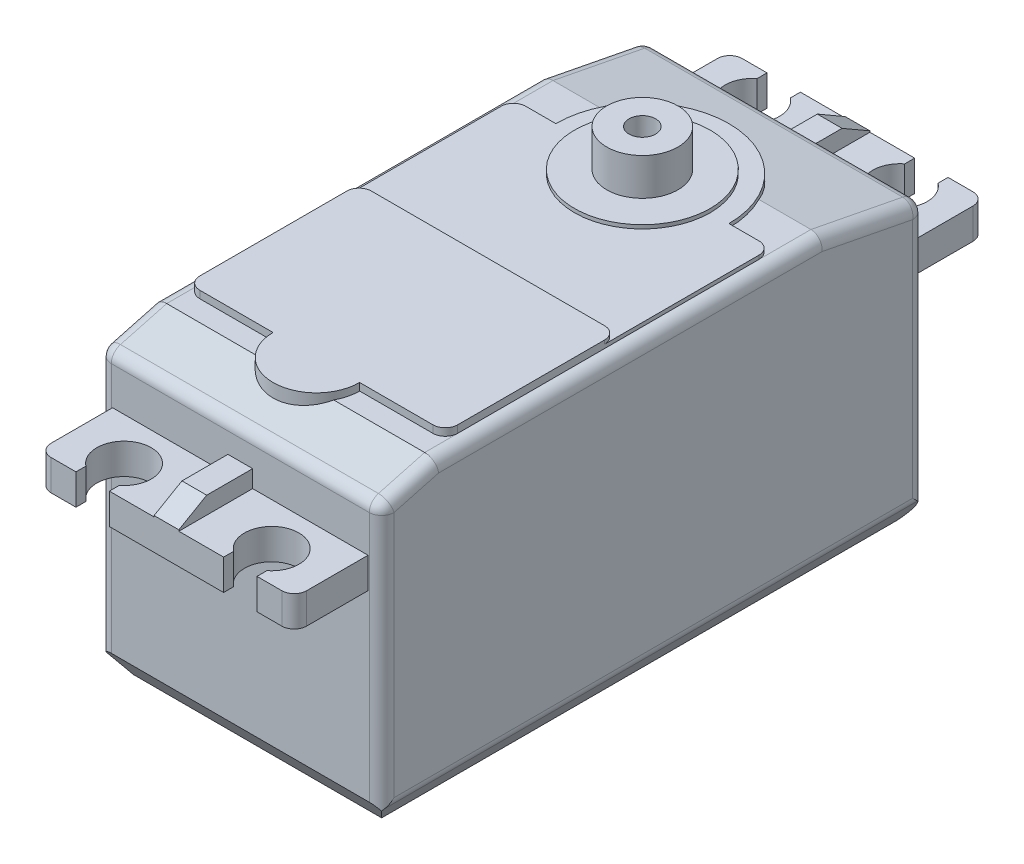
from build123d import *
from OCP.BRepFilletAPI import BRepFilletAPI_MakeChamfer

# Parameters (mm, degrees)
SKETCH_1_W           = 55.88
SKETCH_1_H           = 24.55
EXTRUDE_1_DEPTH      = 22.86
SKETCH_2_W           = 5.969
SKETCH_2_H           = 16.764
CUT_EXTRUDE_1_DEPTH  = 52.049676404
SKETCH_3_W           = 5.969
SKETCH_3_H           = 5.306
CUT_EXTRUDE_2_DEPTH  = 52.049676404
SKETCH_7_W           = 2
SKETCH_7_H           = 1.4
EXTRUDE_2_DEPTH      = 5.969
EXTRUDE_START        = -43.942
SKETCH_7_2_W         = 2
SKETCH_7_2_H         = 1.4
EXTRUDE_5_DEPTH      = 5.969
CUT_EXTRUDE_4_DEPTH  = 45.517005706
SKETCH_12_W          = 7
SKETCH_12_H          = 4
EXTRUDE_4_DEPTH      = 6
EXTRUDE_4_TAPER      = 6
CHAMFER_1_SIZE       = 1.3
CHAMFER_1_SIZE2      = 2.25166605
SKETCH_18_W          = 22.86
SKETCH_18_H          = 43.942
CUT_EXTRUDE_9_DEPTH  = 0.3
EXTRUDE_START_2      = 0.3
EXTRUDE_6_DEPTH      = 0.3
SKETCH_20_W          = 5.969
SKETCH_20_H          = 2.48
CUT_EXTRUDE_10_DEPTH = 1.1
SKETCH_21_W          = 5.969
SKETCH_21_H          = 2.48
CUT_EXTRUDE_11_DEPTH = 1.1
CHAMFER_3_SIZE       = 1.6
CHAMFER_3_SIZE_2     = 8.231286426
CHAMFER_4_SIZE       = 1.2
CHAMFER_4_SIZE_2     = 4.478460969
CHAMFER_5_SIZE       = 2
CHAMFER_5_SIZE2      = 1.400415076
FILLET_1_R           = 1


with BuildPart() as part:
    # Эскиз1 → Бобышка-Вытянуть1 (new body)
    with BuildSketch(Plane(origin=(11.43, 0, 0), x_dir=(0, 0, -1), z_dir=(1, 0, 0))):
        with Locations((-10.541, -12.275)):
            Rectangle(SKETCH_1_W, SKETCH_1_H)
    extrude(amount=-EXTRUDE_1_DEPTH)

    # Эскиз2 → Вырез-Вытянуть1 (cut, through all)
    with BuildSketch(Plane.ZY.offset(11.43)):
        with Locations((-14.4145, -16.168)):
            Rectangle(SKETCH_2_W, SKETCH_2_H)
        with Locations((35.4965, -16.168)):
            Rectangle(SKETCH_2_W, SKETCH_2_H)
    extrude(amount=-CUT_EXTRUDE_1_DEPTH, mode=Mode.SUBTRACT)

    # Эскиз3 → Вырез-Вытянуть2 (cut, through all)
    with BuildSketch(Plane.ZY.offset(11.43)):
        with Locations((-14.4145, -2.653)):
            Rectangle(SKETCH_3_W, SKETCH_3_H)
        with Locations((35.4965, -2.653)):
            Rectangle(SKETCH_3_W, SKETCH_3_H)
    extrude(amount=-CUT_EXTRUDE_2_DEPTH, mode=Mode.SUBTRACT)

    # Эскиз7 → Бобышка-Вытянуть2 (add)
    with BuildSketch(Plane(origin=(0, 0, -11.43), x_dir=(-1, 0, 0), z_dir=(0, 0, -1))):
        with Locations((0, -4.606)):
            Rectangle(SKETCH_7_W, SKETCH_7_H)
    extrude(amount=EXTRUDE_2_DEPTH)

    # Эскиз7<2> → Бобышка-Вытянуть5 (add)
    with BuildSketch(Plane(origin=(0, 0, -11.43), x_dir=(-1, 0, 0), z_dir=(0, 0, -1)).offset(EXTRUDE_START)):
        with Locations((0, -4.606)):
            Rectangle(SKETCH_7_2_W, SKETCH_7_2_H)
    extrude(amount=-EXTRUDE_5_DEPTH)

    # Эскиз5 → Вырез-Вытянуть4 (cut, through all)
    with BuildSketch(Plane(origin=(0, -5.306, 0), x_dir=(-1, 0, 0), z_dir=(0, 1, 0))):
        with BuildLine():
            Line((4.62, -17.399), (7.32, -17.399))
            Line((7.32, -17.399), (7.32, -16.596095277))
            ThreePointArc((7.32, -16.596095277), (5.97, -12.659), (4.62, -16.596095277))
            Line((4.62, -16.596095277), (4.62, -17.399))
        make_face()
        with BuildLine():
            Line((-7.32, -17.399), (-4.62, -17.399))
            Line((-4.62, -17.399), (-4.62, -16.596095277))
            ThreePointArc((-4.62, -16.596095277), (-5.97, -12.659), (-7.32, -16.596095277))
            Line((-7.32, -16.596095277), (-7.32, -17.399))
        make_face()
        with BuildLine():
            Line((-7.32, 37.678095277), (-7.32, 38.481))
            Line((-7.32, 38.481), (-4.62, 38.481))
            Line((-4.62, 38.481), (-4.62, 37.678095277))
            ThreePointArc((-4.62, 37.678095277), (-5.97, 33.741), (-7.32, 37.678095277))
        make_face()
        with BuildLine():
            Line((4.62, 37.678095277), (4.62, 38.481))
            Line((4.62, 38.481), (7.32, 38.481))
            Line((7.32, 38.481), (7.32, 37.678095277))
            ThreePointArc((7.32, 37.678095277), (5.97, 33.741), (4.62, 37.678095277))
        make_face()
    extrude(amount=-CUT_EXTRUDE_4_DEPTH, mode=Mode.SUBTRACT)

    # Эскиз12 → Бобышка-Вытянуть4 (add)
    with BuildSketch(Plane(origin=(0, 0, -11.43), x_dir=(-1, 0, 0), z_dir=(0, 0, -1))):
        with Locations((0, -20.05)):
            Rectangle(SKETCH_12_W, SKETCH_12_H)
    extrude(amount=EXTRUDE_4_DEPTH, taper=EXTRUDE_4_TAPER)

    # Эскиз13 → Повернуть1 (revolve)
    with BuildSketch(Plane.XY, mode=Mode.PRIVATE) as revolve_1_sk:
        Polygon((2.88, 3.3), (1.075, 3.3), (1.075, 0), (5.49, 0), (5.49, 0.3), (2.88, 0.3), align=None)
    revolve(revolve_1_sk.sketch.rotate(Axis((0, 3.776863246, 0), (0, -1, 0)), 270), axis=Axis((0, 3.776863246, 0), (0, -1, 0)))

    # Фаска1: one chamfer whose edges measure the first distance from different faces: ONE call of the kernel's chamfer builder (chamfer() names one face for all edges)
    chamfer_1_edges_1 = [part.edges().sort_by_distance(p)[0] for p in [
        (0, -3.906, -17.399),
    ]]
    chamfer_1_side_1 = [part.faces().sort_by_distance(p)[0] for p in [
        (0, -6.334763066, -17.399),
    ]]
    chamfer_1_edges_2 = [part.edges().sort_by_distance(p)[0] for p in [
        (0, -3.906, 38.481),
    ]]
    chamfer_1_side_2 = [part.faces().sort_by_distance(p)[0] for p in [
        (0, -6.334763066, 38.481),
    ]]
    chamfer_1 = BRepFilletAPI_MakeChamfer(part.part.solid().wrapped)
    for e in chamfer_1_edges_1:
        chamfer_1.Add(CHAMFER_1_SIZE, CHAMFER_1_SIZE2, e.wrapped, chamfer_1_side_1[0].wrapped)  # the first distance lies on this face
    for e in chamfer_1_edges_2:
        chamfer_1.Add(CHAMFER_1_SIZE, CHAMFER_1_SIZE2, e.wrapped, chamfer_1_side_2[0].wrapped)  # the first distance lies on this face
    add(Compound.cast(chamfer_1.Shape()), mode=Mode.REPLACE)

    # Эскиз18 → Вырез-Вытянуть9 (cut)
    with BuildSketch(Plane(origin=(0, 0, 0), x_dir=(1, 0, 0), z_dir=(0, 1, 0))):
        with Locations((0, -10.541)):
            Rectangle(SKETCH_18_W, SKETCH_18_H)
        with BuildLine():
            Line((-10.425, -25.36), (-10.425, -1))
            ThreePointArc((-10.425, -1), (-10.132106781, -0.292893219), (-9.425, 0))
            Line((-9.425, 0), (-7, 0))
            ThreePointArc((-7, 0), (0, 7), (7, 0))
            Line((7, 0), (9.425, 0))
            ThreePointArc((9.425, 0), (10.132106781, -0.292893219), (10.425, -1))
            Line((10.425, -1), (10.425, -25.36))
            ThreePointArc((10.425, -25.36), (10.132106781, -26.067106781), (9.425, -26.36))
            Line((9.425, -26.36), (3.5, -26.36))
            ThreePointArc((3.5, -26.36), (0, -29.86), (-3.5, -26.36))
            Line((-3.5, -26.36), (-9.425, -26.36))
            ThreePointArc((-9.425, -26.36), (-10.132106781, -26.067106781), (-10.425, -25.36))
        make_face(mode=Mode.SUBTRACT)
    extrude(amount=-CUT_EXTRUDE_9_DEPTH, mode=Mode.SUBTRACT)

    # Эскиз19 → Бобышка-Вытянуть6 (add)
    with BuildSketch(Plane(origin=(0, 0, 0), x_dir=(1, 0, 0), z_dir=(0, 1, 0)).offset(EXTRUDE_START_2)):
        with BuildLine():
            Line((-9.425, -12.48), (9.425, -12.48))
            ThreePointArc((9.425, -12.48), (10.132106781, -12.772893219), (10.425, -13.48))
            Line((10.425, -13.48), (10.425, -25.36))
            ThreePointArc((10.425, -25.36), (10.132106781, -26.067106781), (9.425, -26.36))
            Line((9.425, -26.36), (3.5, -26.36))
            ThreePointArc((3.5, -26.36), (0, -29.86), (-3.5, -26.36))
            Line((-3.5, -26.36), (-9.425, -26.36))
            ThreePointArc((-9.425, -26.36), (-10.132106781, -26.067106781), (-10.425, -25.36))
            Line((-10.425, -25.36), (-10.425, -13.48))
            ThreePointArc((-10.425, -13.48), (-10.132106781, -12.772893219), (-9.425, -12.48))
        make_face()
    extrude(amount=-EXTRUDE_6_DEPTH)

    # Эскиз20 → Вырез-Вытянуть10 (cut)
    with BuildSketch(Plane(origin=(11.43, 0, 0), x_dir=(0, 0, -1), z_dir=(1, 0, 0))):
        with Locations((-35.4965, -6.546)):
            Rectangle(SKETCH_20_W, SKETCH_20_H)
        with Locations((14.4145, -6.546)):
            Rectangle(SKETCH_20_W, SKETCH_20_H)
    extrude(amount=-CUT_EXTRUDE_10_DEPTH, mode=Mode.SUBTRACT)

    # Эскиз21 → Вырез-Вытянуть11 (cut)
    with BuildSketch(Plane.ZY.offset(11.43)):
        with Locations((-14.4145, -6.546)):
            Rectangle(SKETCH_21_W, SKETCH_21_H)
        with Locations((35.4965, -6.546)):
            Rectangle(SKETCH_21_W, SKETCH_21_H)
    extrude(amount=-CUT_EXTRUDE_11_DEPTH, mode=Mode.SUBTRACT)

    # Фаска3
    # the kernel refuses this chamfer: 8.231286426, 1.6 mm, written as the material it takes off along each edge
    with BuildSketch(Plane(origin=(32.816798232, -0.3, -11.43), x_dir=(0, -0.9816291836389957, -0.19079870499623175), z_dir=(-1, 0, 0))) as chamfer_3_piece_1_section:
        Polygon((CHAMFER_3_SIZE * 0.981629183639, CHAMFER_3_SIZE * 0.190798704996), (-CHAMFER_3_SIZE_2 * 0.190798704986, CHAMFER_3_SIZE_2 * 0.981629183586), (0, 0), align=None)
    chamfer_3_piece_1 = extrude(amount=65.633596465, mode=Mode.PRIVATE)
    chamfer_3_piece_1 = chamfer_3_piece_1 - Plane(origin=(0, -0.754444143, 0), x_dir=(-1, 0, 0), z_dir=(0, 1, 0)) * Cylinder(7, 164, mode=Mode.PRIVATE)
    add(chamfer_3_piece_1, mode=Mode.SUBTRACT)

    # Фаска4
    # the kernel refuses this chamfer: 4.478460969, 1.2 mm, written as the material it takes off along each edge
    with BuildSketch(Plane(origin=(-23.0593162, -0.3, 32.512), x_dir=(0, -0.9905000388259542, 0.13751244702129095), z_dir=(1, 0, 0))) as chamfer_4_piece_1_section:
        Polygon((CHAMFER_4_SIZE * 0.990500038826, CHAMFER_4_SIZE * 0.137512447021), (-CHAMFER_4_SIZE_2 * 0.137512447024, CHAMFER_4_SIZE_2 * 0.990500038844), (0, 0), align=None)
    chamfer_4_piece_1 = extrude(amount=46.118632399, mode=Mode.PRIVATE)
    chamfer_4_piece_1 = chamfer_4_piece_1 - Plane(origin=(0, -0.658812449, 26.36), x_dir=(1, 0, 0), z_dir=(0, 1, 0)) * Cylinder(3.5, 110, mode=Mode.PRIVATE)
    add(chamfer_4_piece_1, mode=Mode.SUBTRACT)

    # Фаска5: one chamfer whose edges measure the first distance from different faces: ONE call of the kernel's chamfer builder (chamfer() names one face for all edges)
    chamfer_5_edges_1 = [part.edges().sort_by_distance(p)[0] for p in [
        (11.43, -24.55, 10.541),
    ]]
    chamfer_5_side_1 = [part.faces().sort_by_distance(p)[0] for p in [
        (11.43, -12.527087713, 10.608768659),
    ]]
    chamfer_5_edges_2 = [part.edges().sort_by_distance(p)[0] for p in [
        (-11.43, -24.55, 10.541),
    ]]
    chamfer_5_side_2 = [part.faces().sort_by_distance(p)[0] for p in [
        (-11.43, -12.527087713, 10.608768659),
    ]]
    chamfer_5_edges_3 = [part.edges().sort_by_distance(p)[0] for p in [
        (0, -24.55, 32.512),
    ]]
    chamfer_5_side_3 = [part.faces().sort_by_distance(p)[0] for p in [
        (0, -13.776843524, 32.512),
    ]]
    chamfer_5 = BRepFilletAPI_MakeChamfer(part.part.solid().wrapped)
    for e in chamfer_5_edges_1:
        chamfer_5.Add(CHAMFER_5_SIZE, CHAMFER_5_SIZE2, e.wrapped, chamfer_5_side_1[0].wrapped)  # the first distance lies on this face
    for e in chamfer_5_edges_2:
        chamfer_5.Add(CHAMFER_5_SIZE, CHAMFER_5_SIZE2, e.wrapped, chamfer_5_side_2[0].wrapped)  # the first distance lies on this face
    for e in chamfer_5_edges_3:
        chamfer_5.Add(CHAMFER_5_SIZE, CHAMFER_5_SIZE2, e.wrapped, chamfer_5_side_3[0].wrapped)  # the first distance lies on this face
    add(Compound.cast(chamfer_5.Shape()), mode=Mode.REPLACE)

    # Скругление1
    # the kernel refuses this fillet: 1 mm, written as the material it takes off along each edge
    with BuildSketch(Plane(origin=(10.43, -2.724336386, -10.43), x_dir=(0, 0, -1), z_dir=(1, 0, 0))) as fillet_1_piece_1_section:
        Polygon((0, 0), (FILLET_1_R, 0), (FILLET_1_R, FILLET_1_R * 0.824336385817), (FILLET_1_R * 0.190808995377, FILLET_1_R * 0.981627183448), align=None)
    fillet_1_piece_1 = extrude(amount=FILLET_1_R, mode=Mode.PRIVATE)
    fillet_1_piece_1 = fillet_1_piece_1 - Plane(origin=(10.43, -2.724336386, -10.43), x_dir=(0, -0.6360782202776851, 0.771624583387785), z_dir=(1, 0, 0)) * Sphere(FILLET_1_R, mode=Mode.PRIVATE)
    add(fillet_1_piece_1, mode=Mode.SUBTRACT)
    with BuildSketch(Plane(origin=(-10.43, -2.724336386, -10.43), x_dir=(0, 0, -1), z_dir=(-1, 0, 0))) as fillet_1_piece_2_section:
        Polygon((0, 0), (FILLET_1_R, 0), (FILLET_1_R, -FILLET_1_R * 0.824336385817), (FILLET_1_R * 0.190808995377, -FILLET_1_R * 0.981627183448), align=None)
    fillet_1_piece_2 = extrude(amount=FILLET_1_R, mode=Mode.PRIVATE)
    fillet_1_piece_2 = fillet_1_piece_2 - Plane(origin=(-10.43, -2.724336386, -10.43), x_dir=(0, -0.6360782202776851, 0.771624583387785), z_dir=(-1, 0, 0)) * Sphere(FILLET_1_R, mode=Mode.PRIVATE)
    add(fillet_1_piece_2, mode=Mode.SUBTRACT)
    with BuildSketch(Plane(origin=(-10.43, -2.267326988, 31.512), x_dir=(0, 0.9659258262889346, 0.25881904510301973), z_dir=(-1, 0, 0))) as fillet_1_piece_3_section:
        Polygon((0, 0), (FILLET_1_R, 0), (FILLET_1_R, -FILLET_1_R * 0.767326987979), (FILLET_1_R * 0.258819045103, -FILLET_1_R * 0.965925826289), align=None)
    fillet_1_piece_3 = extrude(amount=FILLET_1_R, mode=Mode.PRIVATE)
    fillet_1_piece_3 = fillet_1_piece_3 - Plane(origin=(-10.43, -2.267326988, 31.512), x_dir=(0, -0.6087614290085158, -0.7933533402913924), z_dir=(-1, 0, 0)) * Sphere(FILLET_1_R, mode=Mode.PRIVATE)
    add(fillet_1_piece_3, mode=Mode.SUBTRACT)
    with BuildSketch(Plane(origin=(10.43, -2.267326988, 31.512), x_dir=(0, 0, 1), z_dir=(1, 0, 0))) as fillet_1_piece_4_section:
        Polygon((0, 0), (FILLET_1_R, 0), (FILLET_1_R, -FILLET_1_R * 0.767326987979), (FILLET_1_R * 0.258819045103, -FILLET_1_R * 0.965925826289), align=None)
    fillet_1_piece_4 = extrude(amount=FILLET_1_R, mode=Mode.PRIVATE)
    fillet_1_piece_4 = fillet_1_piece_4 - Plane(origin=(10.43, -2.267326988, 31.512), x_dir=(0, -0.6087614290085158, -0.7933533402913924), z_dir=(1, 0, 0)) * Sphere(FILLET_1_R, mode=Mode.PRIVATE)
    add(fillet_1_piece_4, mode=Mode.SUBTRACT)
    with BuildSketch(Plane(origin=(11.43, -25.05, -11.43), x_dir=(0, 0, 1), z_dir=(0, 1, 0)), Plane(origin=(-11.43, -2.724336386, -11.43), x_dir=(0, 0, 1), z_dir=(0, -1, 0))) as fillet_1_piece_5:
        with BuildLine():
            CenterArc((FILLET_1_R, -FILLET_1_R), FILLET_1_R, 90, 90)
            Line((0, -FILLET_1_R), (0, 0))
            Line((0, 0), (FILLET_1_R, 0))
        make_face()
    extrude(amount=22.325663614, mode=Mode.SUBTRACT)
    with BuildSketch(Plane(origin=(-11.43, -2.267326988, 32.512), x_dir=(1, 0, 0), z_dir=(0, -1, 0)), Plane(origin=(11.43, -25.05, 32.512), x_dir=(-1, 0, 0), z_dir=(0, 1, 0))) as fillet_1_piece_6:
        with BuildLine():
            CenterArc((FILLET_1_R, -FILLET_1_R), FILLET_1_R, 90, 90)
            Line((0, -FILLET_1_R), (0, 0))
            Line((0, 0), (FILLET_1_R, 0))
        make_face()
    extrude(amount=22.782673012, mode=Mode.SUBTRACT)
    with BuildSketch(Plane(origin=(10.33, -2.806, 38.481), x_dir=(0, 0, -1), z_dir=(0, -1, 0)), Plane(origin=(10.33, -10.286, -17.399), x_dir=(0, 0, 1), z_dir=(0, 1, 0))) as fillet_1_piece_7:
        with BuildLine():
            CenterArc((FILLET_1_R, -FILLET_1_R), FILLET_1_R, 90, 90)
            Line((0, -FILLET_1_R), (0, 0))
            Line((0, 0), (FILLET_1_R, 0))
        make_face()
    extrude(amount=7.48, mode=Mode.SUBTRACT)
    with BuildSketch(Plane(origin=(-10.33, -2.806, 38.481), x_dir=(0, 0, -1), z_dir=(0, -1, 0)), Plane(origin=(-10.33, -10.286, -17.399), x_dir=(0, 0, 1), z_dir=(0, 1, 0))) as fillet_1_piece_8:
        with BuildLine():
            CenterArc((FILLET_1_R, FILLET_1_R), FILLET_1_R, 180, 90)
            Line((0, FILLET_1_R), (0, 0))
            Line((0, 0), (FILLET_1_R, 0))
        make_face()
    extrude(amount=7.48, mode=Mode.SUBTRACT)
    with BuildSketch(Plane(origin=(-11.43, 0.347047613, 25.618724465), x_dir=(0, -0.9659258262889345, -0.25881904510301973), z_dir=(0, -0.25881904510301973, 0.9659258262889346)), Plane(origin=(11.43, 0.347047613, 25.618724465), x_dir=(-1, 0, 0), z_dir=(0, -0.25881904510301973, 0.9659258262889346))) as fillet_1_piece_9:
        with BuildLine():
            CenterArc((FILLET_1_R, FILLET_1_R), FILLET_1_R, 180, 90)
            Line((0, FILLET_1_R), (0, 0))
            Line((0, 0), (FILLET_1_R, 0))
        make_face()
    extrude(amount=6.369116978, mode=Mode.SUBTRACT)
    with BuildSketch(Plane(origin=(-11.43, -0.3, -5.698713574), x_dir=(0, -1, 0), z_dir=(0, 0, 1)), Plane(origin=(11.43, -0.3, 30.533539031), x_dir=(0, -1, 0), z_dir=(0, 0, -1))) as fillet_1_piece_10:
        with BuildLine():
            CenterArc((FILLET_1_R, FILLET_1_R), FILLET_1_R, 180, 90)
            Line((0, FILLET_1_R), (0, 0))
            Line((0, 0), (FILLET_1_R, 0))
        make_face()
    extrude(amount=36.232252605, mode=Mode.SUBTRACT)
    with BuildSketch(Plane(origin=(-11.43, -1.742709202, -10.620808995), x_dir=(0, -0.981627183447625, 0.1908089953767454), z_dir=(0, 0.1908089953767454, 0.981627183447625))) as fillet_1_piece_11:
        with BuildLine():
            CenterArc((FILLET_1_R, FILLET_1_R), FILLET_1_R, 180, 90)
            Line((0, FILLET_1_R), (0, 0))
            Line((0, 0), (FILLET_1_R, 0))
        make_face()
    extrude(amount=10.061012517, mode=Mode.SUBTRACT)
    with BuildSketch(Plane(origin=(10.43, -1.9, -11.43), x_dir=(0, -1, 0), z_dir=(-1, 0, 0))) as fillet_1_piece_12:
        with BuildLine():
            CenterArc((FILLET_1_R * 0.824336385817, FILLET_1_R), FILLET_1_R, 191, 79)
            Line((-FILLET_1_R * 0.15729079763, FILLET_1_R * 0.809191004623), (0, 0))
            Line((0, 0), (FILLET_1_R * 0.824336385817, 0))
        make_face()
    extrude(amount=20.86, mode=Mode.SUBTRACT)
    with BuildSketch(Plane(origin=(11.43, -1.742709202, -10.620808995), x_dir=(0, -0.981627183447625, 0.1908089953767454), z_dir=(0, 0.1908089953767454, 0.981627183447625))) as fillet_1_piece_13:
        with BuildLine():
            CenterArc((FILLET_1_R, -FILLET_1_R), FILLET_1_R, 90, 90)
            Line((0, -FILLET_1_R), (0, 0))
            Line((0, 0), (FILLET_1_R, 0))
        make_face()
    extrude(amount=10.061012517, mode=Mode.SUBTRACT)
    with BuildSketch(Plane(origin=(-10.43, -1.5, 32.512), x_dir=(0, -1, 0), z_dir=(1, 0, 0))) as fillet_1_piece_14:
        with BuildLine():
            CenterArc((FILLET_1_R * 0.767326987979, FILLET_1_R), FILLET_1_R, 195, 75)
            Line((-FILLET_1_R * 0.19859883831, FILLET_1_R * 0.741180954897), (0, 0))
            Line((0, 0), (FILLET_1_R * 0.767326987979, 0))
        make_face()
    extrude(amount=20.86, mode=Mode.SUBTRACT)
    with BuildSketch(Plane(origin=(11.43, -22.55, 33.300246972), x_dir=(0, 1, 0), z_dir=(0, 0, -1))) as fillet_1_piece_15:
        with BuildLine():
            CenterArc((FILLET_1_R * 0.315298788879, -FILLET_1_R), FILLET_1_R, 90, 35)
            Line((-FILLET_1_R * 0.258277647472, -FILLET_1_R * 0.180847955711), (0, 0))
            Line((0, 0), (FILLET_1_R * 0.315298788879, 0))
        make_face()
    extrude(amount=45.518493944, mode=Mode.SUBTRACT)
    with BuildSketch(Plane(origin=(-11.43, -22.55, 33.300246972), x_dir=(0, 1, 0), z_dir=(0, 0, -1))) as fillet_1_piece_16:
        with BuildLine():
            CenterArc((FILLET_1_R * 0.315298788879, FILLET_1_R), FILLET_1_R, 235, 35)
            Line((-FILLET_1_R * 0.258277647472, FILLET_1_R * 0.180847955711), (0, 0))
            Line((0, 0), (FILLET_1_R * 0.315298788879, 0))
        make_face()
    extrude(amount=45.518493944, mode=Mode.SUBTRACT)
    with BuildSketch(Plane(origin=(-12.529584924, -24.55, -11.43), x_dir=(0, 1, 0), z_dir=(1, 0, 0))) as fillet_1_piece_17:
        with BuildLine():
            CenterArc((FILLET_1_R, FILLET_1_R), FILLET_1_R, 180, 90)
            Line((0, FILLET_1_R), (0, 0))
            Line((0, 0), (FILLET_1_R, 0))
        make_face()
    extrude(amount=25.059169847, mode=Mode.SUBTRACT)


solid = part.part
